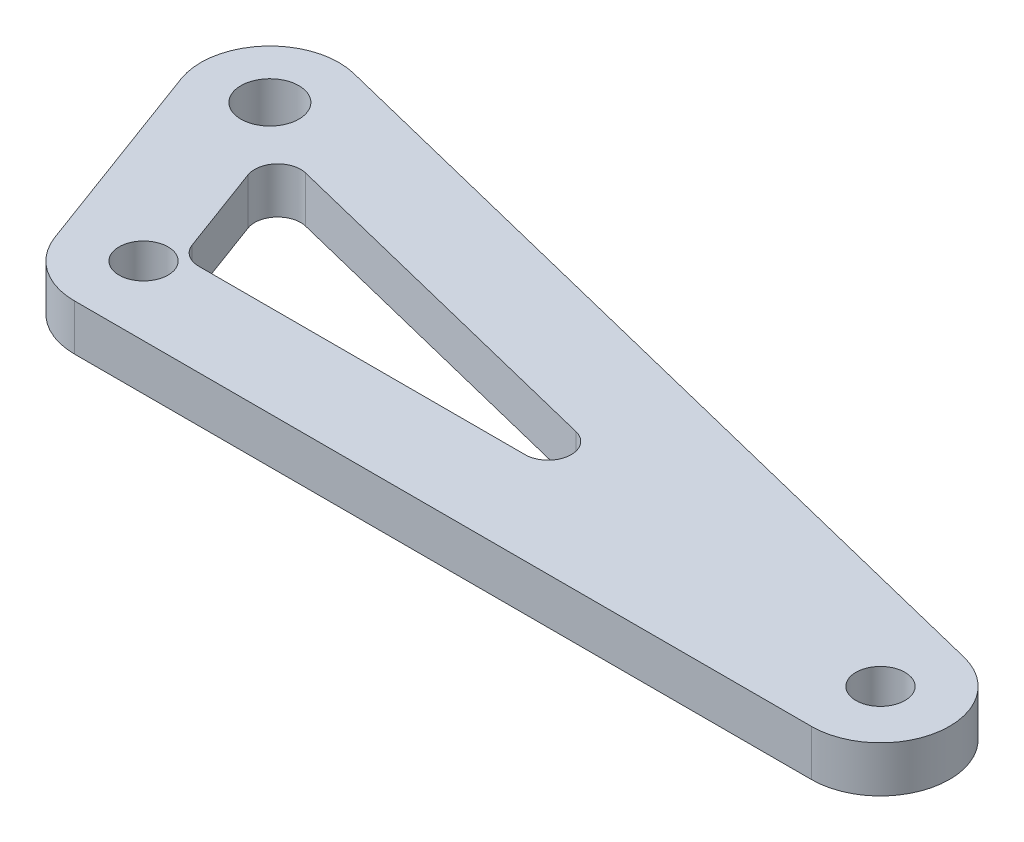
from build123d import *

# Parameters (mm, degrees)
SKETCH1_R           = 4
SKETCH1_R_2         = 3.3782
BOSS_EXTRUDE2_DEPTH = 6.35


with BuildPart() as part:
    # Sketch1 → Boss-Extrude2 (new body)
    with BuildSketch(Plane(origin=(0, 0, 0), x_dir=(1, 0, 0), z_dir=(0, 1, 0))):
        with BuildLine():
            Line((103.850244371, 9.24666012), (-7.94064525, 36.881723073))
            ThreePointArc((-7.94064525, 36.881723073), (-17.328317762, 33.98243214), (-19.159429046, 24.329385234))
            Line((-19.159429046, 24.329385234), (-8.932978817, -3.305679122))
            ThreePointArc((-8.932978817, -3.305679122), (-5.442381435, -7.817039678), (0, -9.525))
            Line((0, -9.525), (101.56444, -9.525))
            ThreePointArc((101.56444, -9.525), (111.019598979, -1.151344291), (103.850244371, 9.24666012))
        make_face()
        with BuildLine():
            Line((49.41646321, 3.175), (4.420998548, 3.175))
            ThreePointArc((4.420998548, 3.175), (2.60687144, 3.744320082), (1.443338974, 5.248106875))
            Line((1.443338974, 5.248106875), (-3.087221692, 17.491097626))
            ThreePointArc((-3.087221692, 17.491097626), (-2.476851738, 20.708780169), (0.652372477, 21.67521084))
            Line((0.652372477, 21.67521084), (50.178397804, 9.432220088))
            ThreePointArc((50.178397804, 9.432220088), (52.568182882, 5.966218669), (49.41646321, 3.175))
        make_face(mode=Mode.SUBTRACT)
        with Locations((-10.226449718, 27.635062977)):
            Circle(SKETCH1_R, mode=Mode.SUBTRACT)
        with Locations((101.56444, 0)):
            Circle(SKETCH1_R_2, mode=Mode.SUBTRACT)
        Circle(SKETCH1_R_2, mode=Mode.SUBTRACT)
    extrude(amount=BOSS_EXTRUDE2_DEPTH)


solid = part.part
